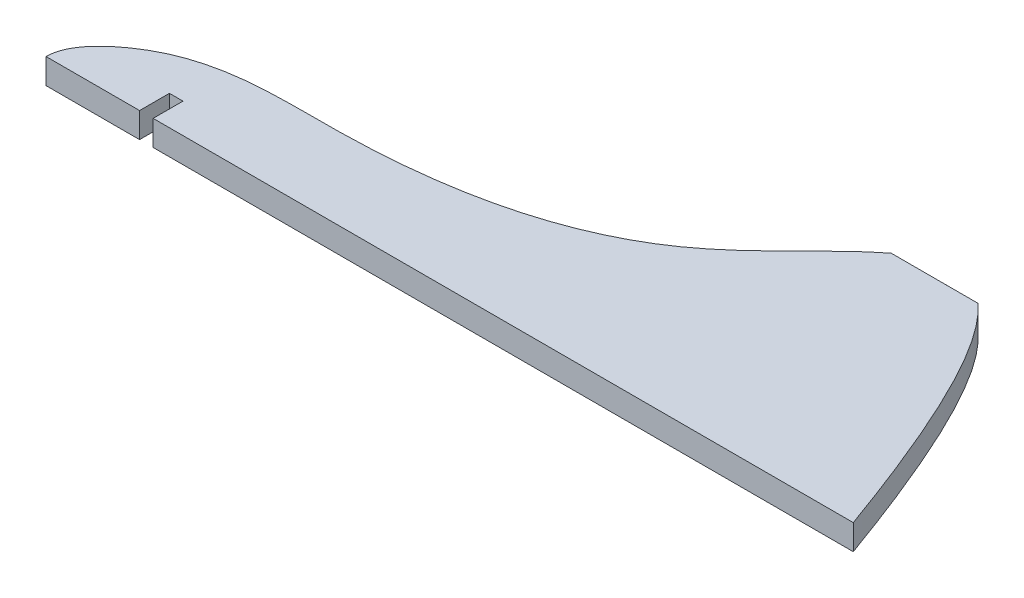
from build123d import *

# Parameters (mm, degrees)
BOSS_EXTRUDE1_DEPTH = 6.35


with BuildPart() as part:
    # Sketch1 → Boss-Extrude1 (new body)
    with BuildSketch(Plane(origin=(0, 0, 0), x_dir=(1, 0, 0), z_dir=(0, 1, 0))):
        with BuildLine():
            Line((171.091645851, 0), (149.254706781, 0))
            add(Edge.make_bspline(
                [(0, -63.5), (-0.004942399, -58.905059088), (15.7354327, -41.535323585), (66.470977364, -45.560282875), (118.968568773, -34.398878853), (141.30099354, -6.032760753), (149.254706781, 0)],
                knots=[0, 0, 0, 0, 0.046674855, 0.207236479, 0.499057155, 0.672741728, 0.672741728, 0.672741728, 0.672741728], degree=3))
            Line((0, -63.5), (23.552531904, -63.5))
            Line((23.552531904, -63.5), (23.552531904, -55.988979912))
            Line((23.552531904, -55.988979912), (26.964138646, -55.988979912))
            Line((26.964138646, -55.988979912), (26.964138646, -63.5))
            Line((26.964138646, -63.5), (203.2, -63.5))
            add(Edge.make_bspline(
                [(171.091645851, 0), (179.832071489, -7.908101772), (189.906572747, -26.703913898), (203.2, -63.5)],
                knots=[0.828163208, 0.828163208, 0.828163208, 0.828163208, 1, 1, 1, 1], degree=3))
        make_face()
    extrude(amount=BOSS_EXTRUDE1_DEPTH)


solid = part.part
